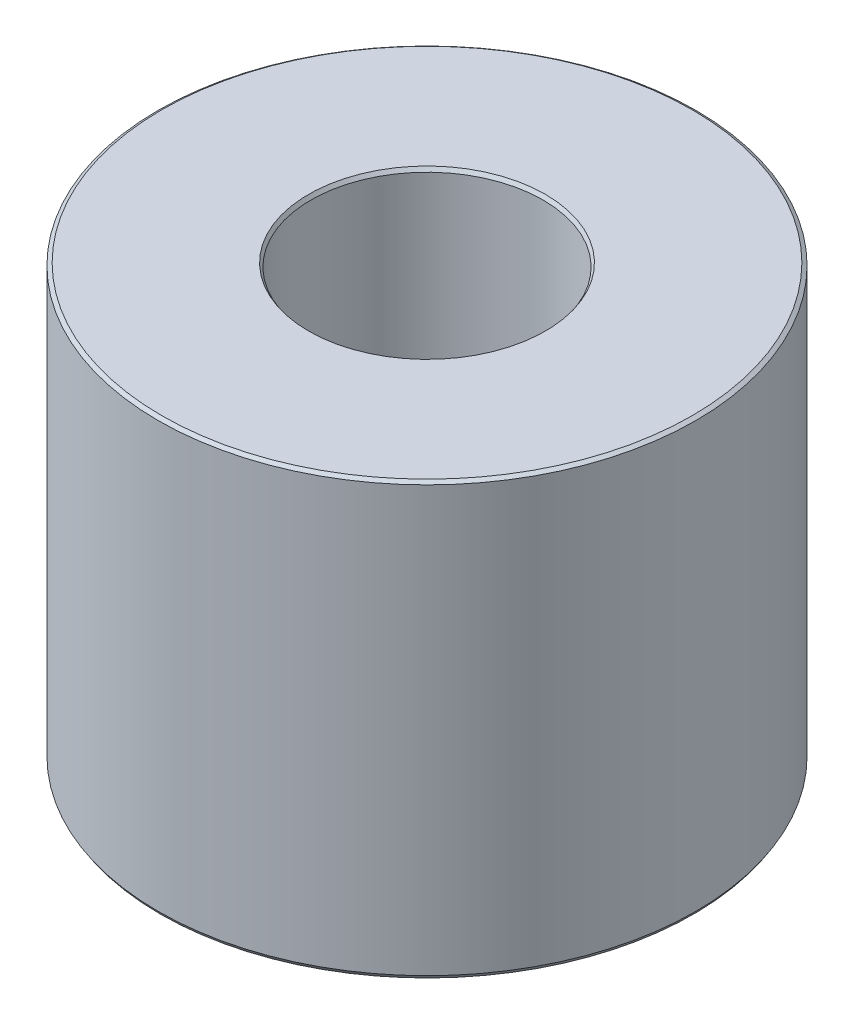
from build123d import *
from OCP.BRepFilletAPI import BRepFilletAPI_MakeChamfer

# Parameters (mm, degrees)
SKETCH1_R           = 57.5
BOSS_EXTRUDE1_DEPTH = 92.2311962
SKETCH2_R           = 24.83045062
CUT_EXTRUDE1_DEPTH  = 123.959723294
CHAMFER1_SIZE       = 0.507309145
CHAMFER1_SIZE2      = 0.78699086


with BuildPart() as part:
    # Sketch1 → Boss-Extrude1 (new body)
    with BuildSketch(Plane(origin=(0, 0, 0), x_dir=(1, 0, 0), z_dir=(0, 1, 0))):
        Circle(SKETCH1_R)
    extrude(amount=BOSS_EXTRUDE1_DEPTH)

    # Sketch2 → Cut-Extrude1 (cut, through all)
    with BuildSketch(Plane(origin=(0, 0, 0), x_dir=(1, 0, 0), z_dir=(0, 1, 0))):
        Circle(SKETCH2_R)
    extrude(amount=CUT_EXTRUDE1_DEPTH, mode=Mode.SUBTRACT)

    # Chamfer1: one chamfer whose edges measure the first distance from different faces: ONE call of the kernel's chamfer builder (chamfer() names one face for all edges)
    chamfer1_edges_1 = [part.edges().sort_by_distance(p)[0] for p in [
        (-24.83045062, 92.2311962, 0),
    ]]
    chamfer1_side_1 = [part.faces().sort_by_distance(p)[0] for p in [
        (-55.873654403, 92.2311962, 0),
    ]]
    chamfer1_edges_2 = [part.edges().sort_by_distance(p)[0] for p in [
        (-24.83045062, 0, 0),
    ]]
    chamfer1_side_2 = [part.faces().sort_by_distance(p)[0] for p in [
        (-24.83045062, 46.1155981, 0),
    ]]
    chamfer1_edges_3 = [part.edges().sort_by_distance(p)[0] for p in [
        (-57.5, 0, 0),
    ]]
    chamfer1_side_3 = [part.faces().sort_by_distance(p)[0] for p in [
        (-55.873654403, 0, 0),
    ]]
    chamfer1_edges_4 = [part.edges().sort_by_distance(p)[0] for p in [
        (-57.5, 92.2311962, 0),
    ]]
    chamfer1_side_4 = [part.faces().sort_by_distance(p)[0] for p in [
        (-57.5, 46.1155981, 0),
    ]]
    chamfer1 = BRepFilletAPI_MakeChamfer(part.part.solid().wrapped)
    for e in chamfer1_edges_1:
        chamfer1.Add(CHAMFER1_SIZE, CHAMFER1_SIZE2, e.wrapped, chamfer1_side_1[0].wrapped)  # the first distance lies on this face
    for e in chamfer1_edges_2:
        chamfer1.Add(CHAMFER1_SIZE, CHAMFER1_SIZE2, e.wrapped, chamfer1_side_2[0].wrapped)  # the first distance lies on this face
    for e in chamfer1_edges_3:
        chamfer1.Add(CHAMFER1_SIZE, CHAMFER1_SIZE2, e.wrapped, chamfer1_side_3[0].wrapped)  # the first distance lies on this face
    for e in chamfer1_edges_4:
        chamfer1.Add(CHAMFER1_SIZE, CHAMFER1_SIZE2, e.wrapped, chamfer1_side_4[0].wrapped)  # the first distance lies on this face
    add(Compound.cast(chamfer1.Shape()), mode=Mode.REPLACE)


solid = part.part
